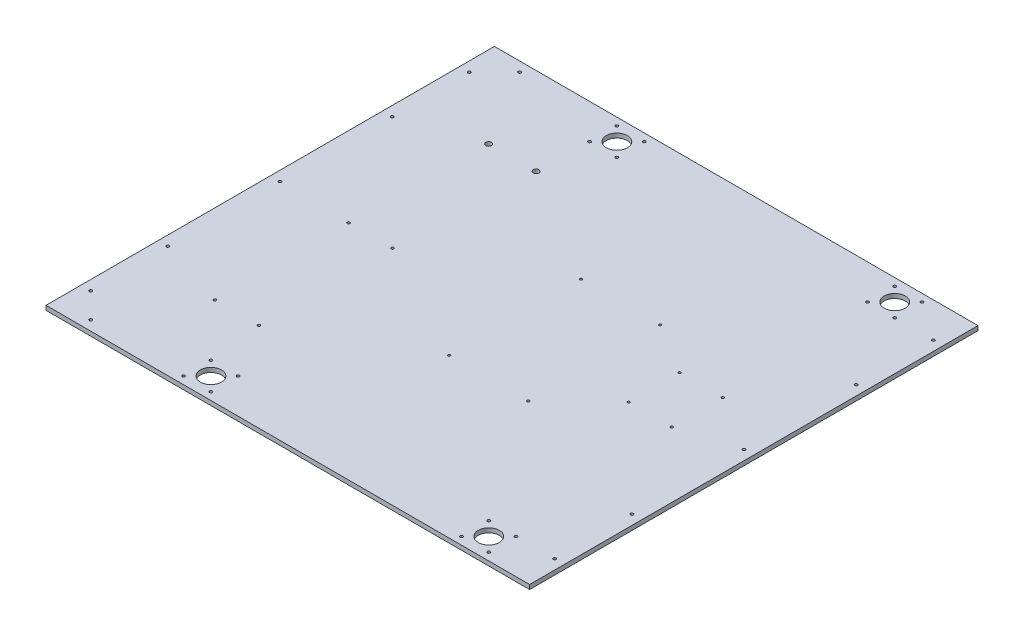
from build123d import *

# Parameters (mm, degrees)
SKETCH1_W                              = 510
SKETCH1_H                              = 5
BOSS_EXTRUDE1_DEPTH                    = 550
BOTTHOMHOLES_SKETCH2_R                 = 12
BOTTHOMHOLES_SKETCH2_R_2               = 1.5875
BOTTOMHOLES_CUT_EXTRUDE1_DEPTH         = 751.083328704
BOTTOMPSUHOLESSKETCH2_R                = 1.5
BOTTOMPSUHOLESSKETCH2_R_2              = 3.25
BOTTOMPSUHOLESCUT_EXTRUDE1_DEPTH       = 751.083328704
BOTTOMMAINBOARDHOLESSKETCH2_R          = 1.35
BOTTOMMAINBOARDHOLESCUT_EXTRUDE1_DEPTH = 751.083328704


with BuildPart() as part:
    # Sketch1 → Boss-Extrude1 (new body)
    with BuildSketch(Plane(origin=(0, 0, 0), x_dir=(0, 0, -1), z_dir=(1, 0, 0))):
        with Locations((-255, 2.5)):
            Rectangle(SKETCH1_W, SKETCH1_H)
    extrude(amount=BOSS_EXTRUDE1_DEPTH)

    # BotthomHoles-Sketch2 → BottomHoles-Cut-Extrude1 (cut, through all)
    with BuildSketch(Plane(origin=(0, 5, 0), x_dir=(1, 0, 0), z_dir=(0, 1, 0))):
        with Locations((479.425, -24.175)):
            Circle(BOTTHOMHOLES_SKETCH2_R)
        with Locations((463.925, -8.675)):
            Circle(BOTTHOMHOLES_SKETCH2_R_2)
        with Locations((494.925, -8.675)):
            Circle(BOTTHOMHOLES_SKETCH2_R_2)
        with Locations((463.925, -39.675)):
            Circle(BOTTHOMHOLES_SKETCH2_R_2)
        with Locations((494.925, -39.675)):
            Circle(BOTTHOMHOLES_SKETCH2_R_2)
        with Locations((39.6875, -11.1125)):
            Circle(BOTTHOMHOLES_SKETCH2_R_2)
        with Locations((178.925, -39.675)):
            Circle(BOTTHOMHOLES_SKETCH2_R_2)
        with Locations((147.925, -39.675)):
            Circle(BOTTHOMHOLES_SKETCH2_R_2)
        with Locations((178.925, -8.675)):
            Circle(BOTTHOMHOLES_SKETCH2_R_2)
        with Locations((147.925, -8.675)):
            Circle(BOTTHOMHOLES_SKETCH2_R_2)
        with Locations((163.425, -24.175)):
            Circle(BOTTHOMHOLES_SKETCH2_R)
        with Locations((39.6875, -498.8875)):
            Circle(BOTTHOMHOLES_SKETCH2_R_2)
        with Locations((147.925, -501.325)):
            Circle(BOTTHOMHOLES_SKETCH2_R_2)
        with Locations((178.925, -501.325)):
            Circle(BOTTHOMHOLES_SKETCH2_R_2)
        with Locations((147.925, -470.325)):
            Circle(BOTTHOMHOLES_SKETCH2_R_2)
        with Locations((178.925, -470.325)):
            Circle(BOTTHOMHOLES_SKETCH2_R_2)
        with Locations((463.925, -470.325)):
            Circle(BOTTHOMHOLES_SKETCH2_R_2)
        with Locations((463.925, -501.325)):
            Circle(BOTTHOMHOLES_SKETCH2_R_2)
        with Locations((494.925, -470.325)):
            Circle(BOTTHOMHOLES_SKETCH2_R_2)
        with Locations((494.925, -501.325)):
            Circle(BOTTHOMHOLES_SKETCH2_R_2)
        with Locations((163.425, -485.825)):
            Circle(BOTTHOMHOLES_SKETCH2_R)
        with Locations((479.425, -485.825)):
            Circle(BOTTHOMHOLES_SKETCH2_R)
        with Locations((11.1125, -39.6875)):
            Circle(BOTTHOMHOLES_SKETCH2_R_2)
        with Locations((11.1125, -127.5)):
            Circle(BOTTHOMHOLES_SKETCH2_R_2)
        with Locations((11.1125, -255)):
            Circle(BOTTHOMHOLES_SKETCH2_R_2)
        with Locations((11.1125, -382.5)):
            Circle(BOTTHOMHOLES_SKETCH2_R_2)
        with Locations((11.1125, -470.3125)):
            Circle(BOTTHOMHOLES_SKETCH2_R_2)
        with Locations((538.8875, -470.3125)):
            Circle(BOTTHOMHOLES_SKETCH2_R_2)
        with Locations((538.8875, -382.5)):
            Circle(BOTTHOMHOLES_SKETCH2_R_2)
        with Locations((538.8875, -255)):
            Circle(BOTTHOMHOLES_SKETCH2_R_2)
        with Locations((538.8875, -127.5)):
            Circle(BOTTHOMHOLES_SKETCH2_R_2)
        with Locations((538.8875, -39.6875)):
            Circle(BOTTHOMHOLES_SKETCH2_R_2)
    extrude(amount=-BOTTOMHOLES_CUT_EXTRUDE1_DEPTH, mode=Mode.SUBTRACT)

    # BottomPSUHolesSketch2 → BottomPSUHolesCut-Extrude1 (cut, through all)
    with BuildSketch(Plane(origin=(0, 5, 0), x_dir=(1, 0, 0), z_dir=(0, 1, 0))):
        with Locations((90.8, -256.7)):
            Circle(BOTTOMPSUHOLESSKETCH2_R)
        with Locations((140.8, -256.7)):
            Circle(BOTTOMPSUHOLESSKETCH2_R)
        with Locations((90.8, -408.7)):
            Circle(BOTTOMPSUHOLESSKETCH2_R)
        with Locations((140.8, -408.7)):
            Circle(BOTTOMPSUHOLESSKETCH2_R)
        with Locations((92.8, -99.3)):
            Circle(BOTTOMPSUHOLESSKETCH2_R_2)
        with Locations((146.8, -99.3)):
            Circle(BOTTOMPSUHOLESSKETCH2_R_2)
    extrude(amount=-BOTTOMPSUHOLESCUT_EXTRUDE1_DEPTH, mode=Mode.SUBTRACT)

    # BottomMainboardHolesSketch2 → BottomMainboardHolesCut-Extrude1 (cut, through all)
    with BuildSketch(Plane(origin=(0, 5, 0), x_dir=(1, 0, 0), z_dir=(0, 1, 0))):
        with Locations((278.5, -180)):
            Circle(BOTTOMMAINBOARDHOLESSKETCH2_R)
        with Locations((368.5, -180)):
            Circle(BOTTOMMAINBOARDHOLESSKETCH2_R)
        with Locations((278.5, -330)):
            Circle(BOTTOMMAINBOARDHOLESSKETCH2_R)
        with Locations((368.5, -330)):
            Circle(BOTTOMMAINBOARDHOLESSKETCH2_R)
        with Locations((426.7, -216)):
            Circle(BOTTOMMAINBOARDHOLESSKETCH2_R)
        with Locations((475.7, -216)):
            Circle(BOTTOMMAINBOARDHOLESSKETCH2_R)
        with Locations((426.7, -274)):
            Circle(BOTTOMMAINBOARDHOLESSKETCH2_R)
        with Locations((475.7, -274)):
            Circle(BOTTOMMAINBOARDHOLESSKETCH2_R)
    extrude(amount=-BOTTOMMAINBOARDHOLESCUT_EXTRUDE1_DEPTH, mode=Mode.SUBTRACT)


solid = part.part
